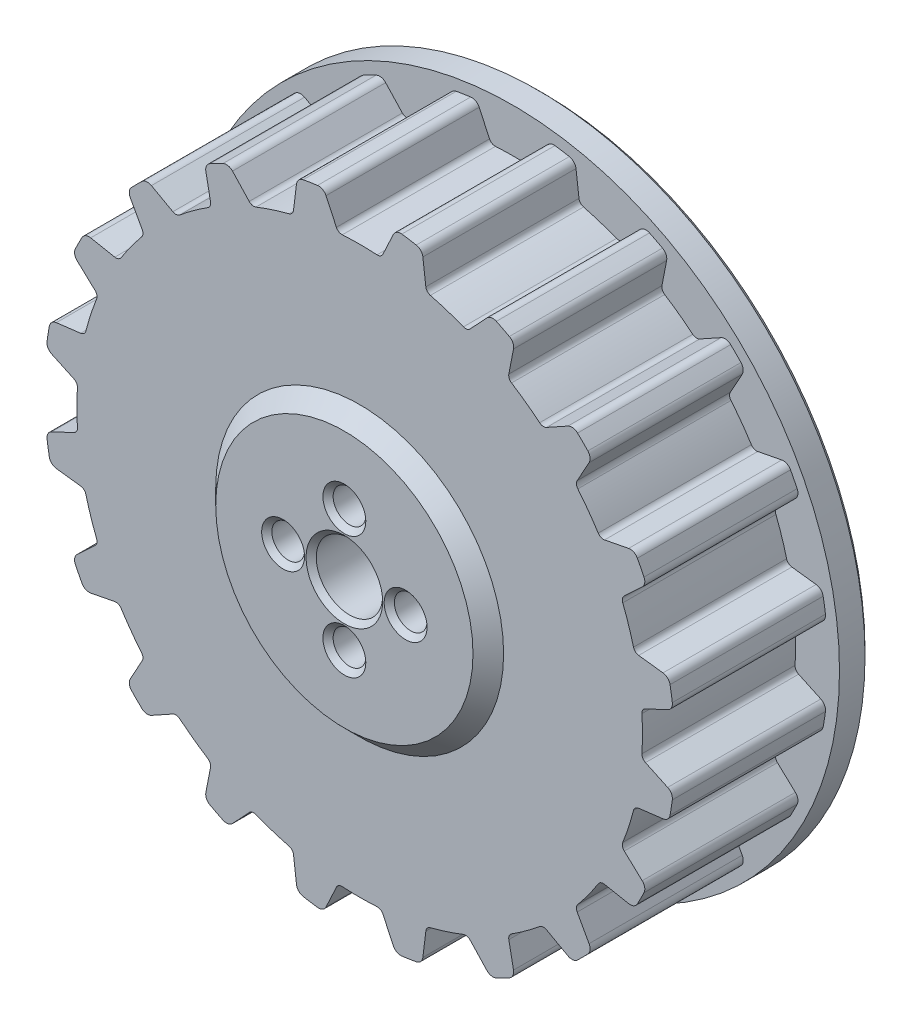
from build123d import *

# Parameters (mm, degrees)
EXTRUDE_1_DEPTH          = 17
PATTERN_CIRCULAR_1_COUNT = 20
SKETCH_4_R               = 32
EXTRUDE_3_DEPTH          = 1
EXTRUDE_START            = 2
SKETCH_5_R               = 32
EXTRUDE_4_DEPTH          = 2
SKETCH_2_R               = 3.25
SKETCH_2_R_2             = 1.6
CUT_EXTRUDE_2_DEPTH      = 49.703182648
EXTRUDE_START_2          = 1.5
SKETCH_6_R               = 12.5
SKETCH_6_R_2             = 1.6
SKETCH_6_R_3             = 3.25
EXTRUDE_5_DEPTH          = 1.5
CHAMFER_1_SIZE           = 0.5
CHAMFER_2_SIZE           = 1.6
CHAMFER_3_SIZE           = 0.5


with BuildPart() as part:
    # ｽｹｯﾁ1 → ﾎﾞｽ - 押し出し1 (new body)
    with BuildSketch(Plane.XY):
        with BuildLine():
            Line((-2.280607777, 27.993082747), (-3.294991863, 30.16843644))
            ThreePointArc((-3.294991863, 30.16843644), (-3.636319467, 30.532310503), (-4.126882959, 30.623174836))
            ThreePointArc((-4.126882959, 30.623174836), (-4.480653429, 30.573415656), (-4.83382497, 30.519569724))
            Line((-4.83382497, 30.519569724), (-0.782172325, 4.938441703))
            ThreePointArc((-0.782172325, 4.938441703), (0, -5), (0.782172325, 4.938441703))
            Line((0.782172325, 4.938441703), (4.83382497, 30.519569724))
            ThreePointArc((4.83382497, 30.519569724), (4.480653429, 30.573415656), (4.126882959, 30.623174836))
            ThreePointArc((4.126882959, 30.623174836), (3.636319467, 30.532310503), (3.294991863, 30.16843644))
            Line((3.294991863, 30.16843644), (2.280607777, 27.993082747))
            ThreePointArc((2.280607777, 27.993082747), (2.043515441, 27.730960181), (1.7, 27.647784721))
            ThreePointArc((1.7, 27.647784721), (0, 27.7), (-1.7, 27.647784721))
            ThreePointArc((-1.7, 27.647784721), (-2.043515441, 27.730960181), (-2.280607777, 27.993082747))
        make_face()
    extrude_1 = extrude(amount=EXTRUDE_1_DEPTH)

    # 円形ﾊﾟﾀｰﾝ1: ﾎﾞｽ - 押し出し1 ×20 about axis
    pattern_circular_1_axis = Axis((0, 0, 0), (0, 0, 1))
    for i in range(1, PATTERN_CIRCULAR_1_COUNT):
        add(extrude_1.rotate(pattern_circular_1_axis, i * 360 / PATTERN_CIRCULAR_1_COUNT))

    # ｽｹｯﾁ4 → ﾎﾞｽ - 押し出し3 (add)
    with BuildSketch(Plane(origin=(0, 0, 0), x_dir=(-1, 0, 0), z_dir=(0, 0, -1))):
        Circle(SKETCH_4_R)
    extrude(amount=EXTRUDE_3_DEPTH)

    # ｽｹｯﾁ5 → ﾎﾞｽ - 押し出し4 (add)
    with BuildSketch(Plane.XY.offset(EXTRUDE_START)):
        Circle(SKETCH_5_R)
    extrude(amount=-EXTRUDE_4_DEPTH)

    # ｽｹｯﾁ2 → ｶｯﾄ - 押し出し2 (cut, through all)
    with BuildSketch(Plane.XY.offset(17)):
        Circle(SKETCH_2_R)
        with Locations((0, 6)):
            Circle(SKETCH_2_R_2)
        with Locations((6, 0)):
            Circle(SKETCH_2_R_2)
        with Locations((0, -6)):
            Circle(SKETCH_2_R_2)
        with Locations((-6, 0)):
            Circle(SKETCH_2_R_2)
    extrude(amount=-CUT_EXTRUDE_2_DEPTH, mode=Mode.SUBTRACT)

    # ｽｹｯﾁ6 → ﾎﾞｽ - 押し出し5 (add)
    with BuildSketch(Plane.XY.offset(17).offset(EXTRUDE_START_2)):
        Circle(SKETCH_6_R)
        with Locations((0, -6)):
            Circle(SKETCH_6_R_2, mode=Mode.SUBTRACT)
        with Locations((6, 0)):
            Circle(SKETCH_6_R_2, mode=Mode.SUBTRACT)
        with Locations((-6, 0)):
            Circle(SKETCH_6_R_2, mode=Mode.SUBTRACT)
        Circle(SKETCH_6_R_3, mode=Mode.SUBTRACT)
        with Locations((0, 6)):
            Circle(SKETCH_6_R_2, mode=Mode.SUBTRACT)
    extrude(amount=-EXTRUDE_5_DEPTH)

    # 面取り1
    chamfer_1_edges = [part.edges().sort_by_distance(p)[0] for p in [
        (-1.6, -6, 18.5),
        (4.4, 0, 18.5),
        (-7.6, 0, 18.5),
        (-3.25, 0, 18.5),
        (-1.6, 6, 18.5),
    ]]
    chamfer(chamfer_1_edges, length=CHAMFER_1_SIZE)

    # 面取り2
    # the kernel refuses this chamfer: 1.6 mm, written as the material it adds along each edge
    with BuildSketch(Plane(origin=(0, 0, 17), x_dir=(1, 0, 0), z_dir=(0, -1, 0))) as chamfer_2_piece_1_section:
        Polygon((12.5, CHAMFER_2_SIZE), (12.5 + CHAMFER_2_SIZE, 0), (12.5, 0), align=None)
    chamfer_2_piece_1 = revolve(axis=Axis((0, 0, 17), (0, 0, 1)), mode=Mode.PRIVATE)
    chamfer_2_piece_1 = split(chamfer_2_piece_1, bisect_by=Plane(origin=(-13.3383239, 0, 18.5), z_dir=(0, 0, -1)), keep=Keep.TOP, mode=Mode.PRIVATE)
    add(chamfer_2_piece_1)

    # 面取り3
    chamfer_3_edges = [part.edges().sort_by_distance(p)[0] for p in [
        (32, 0, -1),
        (-1.6, 6, -1),
        (4.4, 0, -1),
        (-1.6, -6, -1),
        (-7.6, 0, -1),
        (-3.25, 0, -1),
    ]]
    chamfer(chamfer_3_edges, length=CHAMFER_3_SIZE)


solid = part.part
